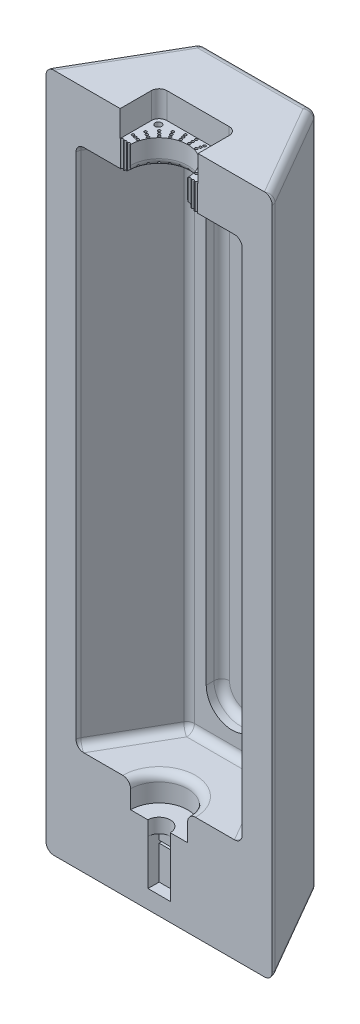
from build123d import *
from build123d.topology import SkipClean

# Parameters (mm, degrees)
BOSS_EXTRUDE1_DEPTH         = 222.04
BOSS_EXTRUDE2_DEPTH         = 30
BOSS_EXTRUDE2_DEPTH_BACK    = 10
BOSS_EXTRUDE3_DEPTH         = 10
BOSS_EXTRUDE3_DEPTH_BACK    = 10
SKETCH6_R                   = 11
CUT_EXTRUDE1_DEPTH          = 10
CUT_EXTRUDE2_START          = -10
SKETCH10_R                  = 11
CUT_EXTRUDE2_DEPTH          = 10
FILLET3_R                   = 3
FILLET4_R                   = 3
CUT_EXTRUDE4_DEPTH          = 10
TAP_DRILL_FOR_M3_TAP1_D     = 2.5
TAP_DRILL_FOR_M3_TAP1_DEPTH = 10
SKETCH11_OUTSIDE_W          = 146.466
SKETCH11_OUTSIDE_H          = 135.592
SKETCH11_OUTSIDE_W_2        = 98.850967549
SKETCH11_OUTSIDE_H_2        = 38.99278009
CUT_EXTRUDE3_DEPTH          = 269.364556366
CAVITY1_START               = -32.973419056
CAVITY1_OUTLINE_W           = 8.6
CAVITY1_OUTLINE_H           = 4.3
CAVITY1_DEPTH               = 17.4
CAVITY1_START_2             = -15.573419056
CAVITY1_2_DEPTH             = 4.6
CAVITY1_START_3             = -19.973419056
CAVITY1_3_OUTLINE_W         = 8.6
CAVITY1_3_OUTLINE_H         = 5.5
CAVITY1_3_OUTLINE_R         = 0.9
CAVITY1_3_DEPTH             = 1
CAVITY1_START_4             = -10.973419056
CAVITY1_4_DEPTH             = 0.935494077
SKETCH16_W                  = 8.6
SKETCH16_H                  = 1
CUT_EXTRUDE6_DEPTH          = 19
CUT_EXTRUDE7_START          = -10.000001
SKETCH17_R                  = 0.5
CUT_EXTRUDE7_DEPTH          = 10.000001
CUT_EXTRUDE8_DEPTH          = 6
FILLET5_R                   = 3
CUT_EXTRUDE9_START          = 2
CUT_EXTRUDE9_DEPTH          = 2


# Read off the part's stored shape, not the designer's step: Cavity1
with BuildPart() as part:
    # Sketch3 → Boss-Extrude1 (new body)
    with BuildSketch(Plane(origin=(0, 212.002075021, 0), x_dir=(1, 0, 0), z_dir=(0, 1, 0))):
        Polygon((-22.023502692, 38.145825623), (-44.047005384, 0), (-22.023502692, -38.145825623), (22.023502692, -38.145825623), (44.047005384, 0), (22.023502692, 38.145825623), align=None)
        Polygon((32.5, 0), (16.25, 28.145825623), (-16.25, 28.145825623), (-32.5, 0), (-16.25, -28.145825623), (16.25, -28.145825623), align=None, mode=Mode.SUBTRACT)
    extrude(amount=-BOSS_EXTRUDE1_DEPTH)

    # Sketch4 → Boss-Extrude2 (add, two sides: drawn at the far end of the back side and taken through both)
    with BuildSketch(Plane.XZ.offset(10.037924979).offset(-BOSS_EXTRUDE2_DEPTH_BACK)):
        Polygon((-22.023502692, -38.145825623), (22.023502692, -38.145825623), (44.047005384, 0), (22.023502692, 38.145825623), (-22.023502692, 38.145825623), (-44.047005384, 0), align=None)
    extrude(amount=BOSS_EXTRUDE2_DEPTH + BOSS_EXTRUDE2_DEPTH_BACK)

    # Sketch5 → Boss-Extrude3 (add, two sides: drawn at the far end of the back side and taken through both)
    with BuildSketch(Plane(origin=(0, 212.002075021, 0), x_dir=(1, 0, 0), z_dir=(0, 1, 0)).offset(-BOSS_EXTRUDE3_DEPTH_BACK)):
        Polygon((22.023502692, 38.145825623), (-22.023502692, 38.145825623), (-44.047005384, 0), (-22.023502692, -38.145825623), (22.023502692, -38.145825623), (44.047005384, 0), align=None)
    extrude(amount=BOSS_EXTRUDE3_DEPTH + BOSS_EXTRUDE3_DEPTH_BACK)

    # Sketch6 → Cut-Extrude1 (cut)
    with BuildSketch(Plane(origin=(0, -0.037924979, 0), x_dir=(1, 0, 0), z_dir=(0, 1, 0))):
        with Locations(Location((0, 0, 0), (0, 0, 270))):
            Circle(SKETCH6_R)
    extrude(amount=-CUT_EXTRUDE1_DEPTH, mode=Mode.SUBTRACT)

    # Sketch10 → Cut-Extrude2 (cut)
    with BuildSketch(Plane.XZ.offset(-202.002075021).offset(CUT_EXTRUDE2_START)):
        with Locations(Location((0, 0, 0), (0, 0, 90))):
            Circle(SKETCH10_R)
    extrude(amount=CUT_EXTRUDE2_DEPTH, mode=Mode.SUBTRACT)

    # Fillet3
    fillet3_edges = [part.edges().sort_by_distance(p)[0] for p in [
        (22.023502692, 90.982075021, -38.145825623),
        (44.047005384, 90.982075021, 0),
        (22.023502692, 90.982075021, 38.145825623),
        (-22.023502692, 90.982075021, 38.145825623),
        (-44.047005384, 90.982075021, 0),
        (-22.023502692, 90.982075021, -38.145825623),
        (-33.035254038, -40.037924979, -19.072912811),
        (0, -40.037924979, -38.145825623),
        (33.035254038, -40.037924979, -19.072912811),
        (33.035254038, -40.037924979, 19.072912811),
        (0, -40.037924979, 38.145825623),
        (-33.035254038, -40.037924979, 19.072912811),
        (33.035254038, 222.002075021, -19.072912811),
        (0, 222.002075021, -38.145825623),
        (-33.035254038, 222.002075021, -19.072912811),
        (-33.035254038, 222.002075021, 19.072912811),
        (0, 222.002075021, 38.145825623),
        (33.035254038, 222.002075021, 19.072912811),
    ]]
    fillet(fillet3_edges, radius=FILLET3_R)

    # Fillet4
    fillet4_edges = [part.edges().sort_by_distance(p)[0] for p in [
        (0, -0.037924979, -11),
        (0, 202.002075021, -11),
        (16.25, 100.982075021, -28.145825623),
        (32.5, 100.982075021, 0),
        (24.375, -0.037924979, -14.072912811),
        (-16.25, 100.982075021, -28.145825623),
        (-32.5, 100.982075021, 0),
        (-16.25, 100.982075021, 28.145825623),
        (16.25, 100.982075021, 28.145825623),
        (0, -0.037924979, 28.145825623),
        (24.375, -0.037924979, 14.072912811),
        (0, -0.037924979, -28.145825623),
        (-24.375, -0.037924979, -14.072912811),
        (-24.375, -0.037924979, 14.072912811),
        (24.375, 202.002075021, -14.072912811),
        (24.375, 202.002075021, 14.072912811),
        (0, 202.002075021, 28.145825623),
        (-24.375, 202.002075021, 14.072912811),
        (-24.375, 202.002075021, -14.072912811),
        (0, 202.002075021, -28.145825623),
    ]]
    fillet(fillet4_edges, radius=FILLET4_R)

    # Sketch12 → Cut-Extrude4 (cut)
    with BuildSketch(Plane(origin=(0, 222.002075021, 0), x_dir=(1, 0, 0), z_dir=(0, 1, 0))):
        with BuildLine():
            Line((15, -12), (15, 12))
            ThreePointArc((15, 12), (14.121320344, 14.121320344), (12, 15))
            Line((12, 15), (-12, 15))
            ThreePointArc((-12, 15), (-14.121320344, 14.121320344), (-15, 12))
            Line((-15, 12), (-15, -12))
            ThreePointArc((-15, -12), (-14.121320344, -14.121320344), (-12, -15))
            Line((-12, -15), (12, -15))
            ThreePointArc((12, -15), (14.121320344, -14.121320344), (15, -12))
        make_face()
    extrude(amount=-CUT_EXTRUDE4_DEPTH, mode=Mode.SUBTRACT)

    # Tap Drill for M3 Tap1
    with Locations(Plane(origin=(0, 212.002075021, 0), x_dir=(1, 0, 0), z_dir=(0, 1, 0))):
        with Locations((12, -12), (-12, -12), (-12.299594867, 12), (12, 12)):
            Hole(TAP_DRILL_FOR_M3_TAP1_D / 2, depth=TAP_DRILL_FOR_M3_TAP1_DEPTH)

    # Sketch11 outside → Cut-Extrude3 (cut, through all)
    with BuildSketch(Plane(origin=(0, 222.002075021, 0), x_dir=(1, 0, 0), z_dir=(0, 1, 0))):
        Rectangle(SKETCH11_OUTSIDE_W, SKETCH11_OUTSIDE_H)
        with Locations((-5.37847839, 19.496390045)):
            Rectangle(SKETCH11_OUTSIDE_W_2, SKETCH11_OUTSIDE_H_2, mode=Mode.SUBTRACT)
    extrude(amount=-CUT_EXTRUDE3_DEPTH, mode=Mode.SUBTRACT)

    # Cavity1 outline → Cavity1 (cut)
    with BuildSketch(Plane(origin=(0, 0, 0), x_dir=(1, 0, 0), z_dir=(0, 1, 0)).offset(CAVITY1_START)):
        with Locations((0, 2.15)):
            Rectangle(CAVITY1_OUTLINE_W, CAVITY1_OUTLINE_H)
    extrude(amount=CAVITY1_DEPTH, mode=Mode.SUBTRACT)

    # Cavity1 2 outline → Cavity1 2 (cut)
    with BuildSketch(Plane(origin=(0, 0, 0), x_dir=(1, 0, 0), z_dir=(0, 1, 0)).offset(CAVITY1_START_2)):
        with BuildLine():
            ThreePointArc((4.3, 0), (0, 4.3), (-4.3, 0))
            Line((-4.3, 0), (4.3, 0))
        make_face()
    extrude(amount=CAVITY1_2_DEPTH, mode=Mode.SUBTRACT)

    # Cavity1 3 outline → Cavity1 3 (cut)
    with BuildSketch(Plane(origin=(0, 0, 0), x_dir=(1, 0, 0), z_dir=(0, 1, 0)).offset(CAVITY1_START_3)):
        with Locations((0, 7.05)):
            Rectangle(CAVITY1_3_OUTLINE_W, CAVITY1_3_OUTLINE_H)
        with Locations((0, 7.3)):
            Circle(CAVITY1_3_OUTLINE_R, mode=Mode.SUBTRACT)
    extrude(amount=CAVITY1_3_DEPTH, mode=Mode.SUBTRACT)

    # Cavity1 4 outline → Cavity1 4 (cut)
    with BuildSketch(Plane(origin=(0, 0, 0), x_dir=(1, 0, 0), z_dir=(0, 1, 0)).offset(CAVITY1_START_4)):
        with BuildLine():
            Line((2.135266823, 0.152927612), (1.985427509, 0.240001904))
            Line((1.985427509, 0.240001904), (2.111642048, 0.365506334))
            ThreePointArc((2.111642048, 0.365506334), (2.163950632, 0.558544703), (2.022928792, 0.70036445))
            Line((2.022928792, 0.70036445), (1.855658643, 0.745690489))
            Line((1.855658643, 0.745690489), (1.94508959, 0.899585186))
            ThreePointArc((1.94508959, 0.899585186), (1.945653795, 1.09958439), (1.772731507, 1.200072609))
            Line((1.772731507, 1.200072609), (1.599429708, 1.2005615))
            Line((1.599429708, 1.2005615), (1.64598249, 1.372358794))
            ThreePointArc((1.64598249, 1.372358794), (1.594763868, 1.565689218), (1.401725499, 1.617997802))
            Line((1.401725499, 1.617997802), (1.234202281, 1.573616229))
            Line((1.234202281, 1.573616229), (1.234704404, 1.751608418))
            ThreePointArc((1.234704404, 1.751608418), (1.135193419, 1.925094913), (0.935194215, 1.925659119))
            Line((0.935194215, 1.925659119), (0.784866008, 1.839431612))
            Line((0.784866008, 1.839431612), (0.739283254, 2.011488824))
            ThreePointArc((0.739283254, 2.011488824), (0.598261414, 2.153308571), (0.40493099, 2.102089949))
            Line((0.40493099, 2.102089949), (0.282042414, 1.97989277))
            Line((0.282042414, 1.97989277), (0.193481171, 2.13428959))
            ThreePointArc((0.193481171, 2.13428959), (0.020558882, 2.234777809), (-0.152927612, 2.135266823))
            Line((-0.152927612, 2.135266823), (-0.240001904, 1.985427509))
            Line((-0.240001904, 1.985427509), (-0.365506334, 2.111642048))
            ThreePointArc((-0.365506334, 2.111642048), (-0.558544703, 2.163950632), (-0.70036445, 2.022928792))
            Line((-0.70036445, 2.022928792), (-0.745690489, 1.855658643))
            Line((-0.745690489, 1.855658643), (-0.899585186, 1.94508959))
            ThreePointArc((-0.899585186, 1.94508959), (-1.09958439, 1.945653795), (-1.200072609, 1.772731507))
            Line((-1.200072609, 1.772731507), (-1.2005615, 1.599429708))
            Line((-1.2005615, 1.599429708), (-1.372358794, 1.64598249))
            ThreePointArc((-1.372358794, 1.64598249), (-1.565689218, 1.594763868), (-1.617997802, 1.401725499))
            Line((-1.617997802, 1.401725499), (-1.573616229, 1.234202281))
            Line((-1.573616229, 1.234202281), (-1.751608418, 1.234704404))
            ThreePointArc((-1.751608418, 1.234704404), (-1.925094913, 1.135193419), (-1.925659119, 0.935194215))
            Line((-1.925659119, 0.935194215), (-1.839431612, 0.784866008))
            Line((-1.839431612, 0.784866008), (-2.011488824, 0.739283254))
            ThreePointArc((-2.011488824, 0.739283254), (-2.153308571, 0.598261414), (-2.102089949, 0.40493099))
            Line((-2.102089949, 0.40493099), (-1.97989277, 0.282042414))
            Line((-1.97989277, 0.282042414), (-2.13428959, 0.193481171))
            ThreePointArc((-2.13428959, 0.193481171), (-2.212642732, 0.111451509), (-2.233776627, 0))
            Line((-2.233776627, 0), (-0.75, 0))
            ThreePointArc((-0.75, 0), (0, 0.75), (0.75, 0))
            Line((0.75, 0), (2.233776627, 0))
            ThreePointArc((2.233776627, 0), (2.202914608, 0.08831176), (2.135266823, 0.152927612))
        make_face()
    extrude(amount=CAVITY1_4_DEPTH, mode=Mode.SUBTRACT)

    # Sketch16 → Cut-Extrude6 (cut)
    with BuildSketch(Plane.XY.offset(-9.8)):
        with Locations((0, -19.473419056)):
            Rectangle(SKETCH16_W, SKETCH16_H)
    extrude(amount=CUT_EXTRUDE6_DEPTH, mode=Mode.SUBTRACT)

    # Sketch17 → Cut-Extrude7 (cut)
    with BuildSketch(Plane(origin=(0, 212.002075021, 0), x_dir=(1, 0, 0), z_dir=(0, 1, 0)).offset(CUT_EXTRUDE7_START)):
        with Locations((-11.7, 0)):
            Circle(SKETCH17_R)
        with Locations((-13, 0)):
            Circle(SKETCH17_R)
        with Locations((-14.3, 0)):
            Circle(SKETCH17_R)
        with Locations(Location((-11.301332168, 3.028182828, 0), (0, 0, 270))):
            Circle(SKETCH17_R)
        with Locations(Location((-12.557035742, 3.364647586, 0), (0, 0, 270))):
            Circle(SKETCH17_R)
        with Locations(Location((-13.812739316, 3.701112345, 0), (0, 0, 270))):
            Circle(SKETCH17_R)
        with Locations(Location((-10.132497224, 5.85, 0), (0, 0, 270))):
            Circle(SKETCH17_R)
        with Locations(Location((-11.258330249, 6.5, 0), (0, 0, 270))):
            Circle(SKETCH17_R)
        with Locations(Location((-12.384163274, 7.15, 0), (0, 0, 270))):
            Circle(SKETCH17_R)
        with Locations(Location((-8.27314934, 8.27314934, 0), (0, 0, 270))):
            Circle(SKETCH17_R)
        with Locations(Location((-9.192388155, 9.192388155, 0), (0, 0, 270))):
            Circle(SKETCH17_R)
        with Locations(Location((-10.111626971, 10.111626971, 0), (0, 0, 270))):
            Circle(SKETCH17_R)
        with Locations(Location((-5.85, 10.132497224, 0), (0, 0, 270))):
            Circle(SKETCH17_R)
        with Locations(Location((-6.5, 11.258330249, 0), (0, 0, 270))):
            Circle(SKETCH17_R)
        with Locations(Location((-7.15, 12.384163274, 0), (0, 0, 270))):
            Circle(SKETCH17_R)
        with Locations(Location((-3.028182828, 11.301332168, 0), (0, 0, 270))):
            Circle(SKETCH17_R)
        with Locations(Location((-3.364647586, 12.557035742, 0), (0, 0, 270))):
            Circle(SKETCH17_R)
        with Locations(Location((-3.701112345, 13.812739316, 0), (0, 0, 270))):
            Circle(SKETCH17_R)
        with Locations(Location((0, 11.7, 0), (0, 0, 270))):
            Circle(SKETCH17_R)
        with Locations(Location((0, 13, 0), (0, 0, 270))):
            Circle(SKETCH17_R)
        with Locations(Location((0, 14.3, 0), (0, 0, 270))):
            Circle(SKETCH17_R)
        with Locations(Location((3.028182828, 11.301332168, 0), (0, 0, 270))):
            Circle(SKETCH17_R)
        with Locations(Location((3.364647586, 12.557035742, 0), (0, 0, 270))):
            Circle(SKETCH17_R)
        with Locations(Location((3.701112345, 13.812739316, 0), (0, 0, 270))):
            Circle(SKETCH17_R)
        with Locations(Location((5.85, 10.132497224, 0), (0, 0, 270))):
            Circle(SKETCH17_R)
        with Locations(Location((6.5, 11.258330249, 0), (0, 0, 270))):
            Circle(SKETCH17_R)
        with Locations(Location((7.15, 12.384163274, 0), (0, 0, 270))):
            Circle(SKETCH17_R)
        with Locations(Location((8.27314934, 8.27314934, 0), (0, 0, 270))):
            Circle(SKETCH17_R)
        with Locations(Location((9.192388155, 9.192388155, 0), (0, 0, 270))):
            Circle(SKETCH17_R)
        with Locations(Location((10.111626971, 10.111626971, 0), (0, 0, 270))):
            Circle(SKETCH17_R)
        with Locations(Location((10.132497224, 5.85, 0), (0, 0, 270))):
            Circle(SKETCH17_R)
        with Locations(Location((11.258330249, 6.5, 0), (0, 0, 270))):
            Circle(SKETCH17_R)
        with Locations(Location((12.384163274, 7.15, 0), (0, 0, 270))):
            Circle(SKETCH17_R)
        with Locations(Location((11.301332168, 3.028182828, 0), (0, 0, 270))):
            Circle(SKETCH17_R)
        with Locations(Location((12.557035742, 3.364647586, 0), (0, 0, 270))):
            Circle(SKETCH17_R)
        with Locations(Location((13.812739316, 3.701112345, 0), (0, 0, 270))):
            Circle(SKETCH17_R)
        with Locations((11.7, 0)):
            Circle(SKETCH17_R)
        with Locations((13, 0)):
            Circle(SKETCH17_R)
        with Locations((14.3, 0)):
            Circle(SKETCH17_R)
    extrude(amount=CUT_EXTRUDE7_DEPTH, mode=Mode.SUBTRACT)

    # Sketch18 → Cut-Extrude8 (cut)
    with BuildSketch(Plane.XY.offset(-28.145825623)):
        with BuildLine():
            Line((10, 184.002075021), (10, 17.962075021))
            ThreePointArc((10, 17.962075021), (0, 7.962075021), (-10, 17.962075021))
            Line((-10, 17.962075021), (-10, 184.002075021))
            ThreePointArc((-10, 184.002075021), (0, 194.002075021), (10, 184.002075021))
        make_face()
    extrude(amount=-CUT_EXTRUDE8_DEPTH, mode=Mode.SUBTRACT)

    # Fillet5
    fillet5_edges = [part.edges().sort_by_distance(p)[0] for p in [
        (0, 194.002075021, -34.145825623),
        (10, 100.982075021, -34.145825623),
        (0, 7.962075021, -34.145825623),
        (-10, 100.982075021, -34.145825623),
    ]]
    fillet(fillet5_edges, radius=FILLET5_R)

    # Sketch15 → Cut-Extrude9 (cut)
    with SkipClean():  # the faces are left unmerged after this step: merging them gives an invalid solid
        with BuildSketch(Plane.XZ.offset(10.037924979).offset(CUT_EXTRUDE9_START)):
            with BuildLine():
                ThreePointArc((2.135266823, -0.152927612), (2.202914608, -0.08831176), (2.233776627, 0))
                Line((2.233776627, 0), (-2.233776627, 0))
                ThreePointArc((-2.233776627, 0), (-2.212642732, -0.111451509), (-2.13428959, -0.193481171))
                Line((-2.13428959, -0.193481171), (-1.97989277, -0.282042414))
                Line((-1.97989277, -0.282042414), (-2.102089949, -0.40493099))
                ThreePointArc((-2.102089949, -0.40493099), (-2.153308571, -0.598261414), (-2.011488824, -0.739283254))
                Line((-2.011488824, -0.739283254), (-1.839431612, -0.784866008))
                Line((-1.839431612, -0.784866008), (-1.925659119, -0.935194215))
                ThreePointArc((-1.925659119, -0.935194215), (-1.925094913, -1.135193419), (-1.751608418, -1.234704404))
                Line((-1.751608418, -1.234704404), (-1.573616229, -1.234202281))
                Line((-1.573616229, -1.234202281), (-1.617997802, -1.401725499))
                ThreePointArc((-1.617997802, -1.401725499), (-1.565689218, -1.594763868), (-1.372358794, -1.64598249))
                Line((-1.372358794, -1.64598249), (-1.2005615, -1.599429708))
                Line((-1.2005615, -1.599429708), (-1.200072609, -1.772731507))
                ThreePointArc((-1.200072609, -1.772731507), (-1.09958439, -1.945653795), (-0.899585186, -1.94508959))
                Line((-0.899585186, -1.94508959), (-0.745690489, -1.855658643))
                Line((-0.745690489, -1.855658643), (-0.70036445, -2.022928792))
                ThreePointArc((-0.70036445, -2.022928792), (-0.558544703, -2.163950632), (-0.365506334, -2.111642048))
                Line((-0.365506334, -2.111642048), (-0.240001904, -1.985427509))
                Line((-0.240001904, -1.985427509), (-0.152927612, -2.135266823))
                ThreePointArc((-0.152927612, -2.135266823), (0.020558883, -2.234777809), (0.193481171, -2.13428959))
                Line((0.193481171, -2.13428959), (0.282042414, -1.97989277))
                Line((0.282042414, -1.97989277), (0.40493099, -2.102089949))
                ThreePointArc((0.40493099, -2.102089949), (0.598261414, -2.153308571), (0.739283254, -2.011488824))
                Line((0.739283254, -2.011488824), (0.784866008, -1.839431612))
                Line((0.784866008, -1.839431612), (0.935194215, -1.925659119))
                ThreePointArc((0.935194215, -1.925659119), (1.135193419, -1.925094913), (1.234704404, -1.751608418))
                Line((1.234704404, -1.751608418), (1.234202281, -1.573616229))
                Line((1.234202281, -1.573616229), (1.401725499, -1.617997802))
                ThreePointArc((1.401725499, -1.617997802), (1.594763868, -1.565689218), (1.64598249, -1.372358794))
                Line((1.64598249, -1.372358794), (1.599429708, -1.2005615))
                Line((1.599429708, -1.2005615), (1.772731507, -1.200072609))
                ThreePointArc((1.772731507, -1.200072609), (1.945653795, -1.09958439), (1.94508959, -0.899585186))
                Line((1.94508959, -0.899585186), (1.855658643, -0.745690489))
                Line((1.855658643, -0.745690489), (2.022928792, -0.70036445))
                ThreePointArc((2.022928792, -0.70036445), (2.163950632, -0.558544703), (2.111642048, -0.365506334))
                Line((2.111642048, -0.365506334), (1.985427509, -0.240001904))
                Line((1.985427509, -0.240001904), (2.135266823, -0.152927612))
            make_face()
            with BuildLine():
                ThreePointArc((-4.3, 0), (0, -4.3), (4.3, 0))
                Line((4.3, 0), (2.233776627, 0))
                ThreePointArc((2.233776627, 0), (2.202914608, -0.08831176), (2.135266823, -0.152927612))
                Line((2.135266823, -0.152927612), (1.985427509, -0.240001904))
                Line((1.985427509, -0.240001904), (2.111642048, -0.365506334))
                ThreePointArc((2.111642048, -0.365506334), (2.163950632, -0.558544703), (2.022928792, -0.70036445))
                Line((2.022928792, -0.70036445), (1.855658643, -0.745690489))
                Line((1.855658643, -0.745690489), (1.94508959, -0.899585186))
                ThreePointArc((1.94508959, -0.899585186), (1.945653795, -1.09958439), (1.772731507, -1.200072609))
                Line((1.772731507, -1.200072609), (1.599429708, -1.2005615))
                Line((1.599429708, -1.2005615), (1.64598249, -1.372358794))
                ThreePointArc((1.64598249, -1.372358794), (1.594763868, -1.565689218), (1.401725499, -1.617997802))
                Line((1.401725499, -1.617997802), (1.234202281, -1.573616229))
                Line((1.234202281, -1.573616229), (1.234704404, -1.751608418))
                ThreePointArc((1.234704404, -1.751608418), (1.135193419, -1.925094913), (0.935194215, -1.925659119))
                Line((0.935194215, -1.925659119), (0.784866008, -1.839431612))
                Line((0.784866008, -1.839431612), (0.739283254, -2.011488824))
                ThreePointArc((0.739283254, -2.011488824), (0.598261414, -2.153308571), (0.40493099, -2.102089949))
                Line((0.40493099, -2.102089949), (0.282042414, -1.97989277))
                Line((0.282042414, -1.97989277), (0.193481171, -2.13428959))
                ThreePointArc((0.193481171, -2.13428959), (0.020558883, -2.234777809), (-0.152927612, -2.135266823))
                Line((-0.152927612, -2.135266823), (-0.240001904, -1.985427509))
                Line((-0.240001904, -1.985427509), (-0.365506334, -2.111642048))
                ThreePointArc((-0.365506334, -2.111642048), (-0.558544703, -2.163950632), (-0.70036445, -2.022928792))
                Line((-0.70036445, -2.022928792), (-0.745690489, -1.855658643))
                Line((-0.745690489, -1.855658643), (-0.899585186, -1.94508959))
                ThreePointArc((-0.899585186, -1.94508959), (-1.09958439, -1.945653795), (-1.200072609, -1.772731507))
                Line((-1.200072609, -1.772731507), (-1.2005615, -1.599429708))
                Line((-1.2005615, -1.599429708), (-1.372358794, -1.64598249))
                ThreePointArc((-1.372358794, -1.64598249), (-1.565689218, -1.594763868), (-1.617997802, -1.401725499))
                Line((-1.617997802, -1.401725499), (-1.573616229, -1.234202281))
                Line((-1.573616229, -1.234202281), (-1.751608418, -1.234704404))
                ThreePointArc((-1.751608418, -1.234704404), (-1.925094913, -1.135193419), (-1.925659119, -0.935194215))
                Line((-1.925659119, -0.935194215), (-1.839431612, -0.784866008))
                Line((-1.839431612, -0.784866008), (-2.011488824, -0.739283254))
                ThreePointArc((-2.011488824, -0.739283254), (-2.153308571, -0.598261414), (-2.102089949, -0.40493099))
                Line((-2.102089949, -0.40493099), (-1.97989277, -0.282042414))
                Line((-1.97989277, -0.282042414), (-2.13428959, -0.193481171))
                ThreePointArc((-2.13428959, -0.193481171), (-2.212642732, -0.111451509), (-2.233776627, 0))
                Line((-2.233776627, 0), (-4.3, 0))
            make_face()
        extrude(amount=-CUT_EXTRUDE9_DEPTH, mode=Mode.SUBTRACT)


solid = part.part
